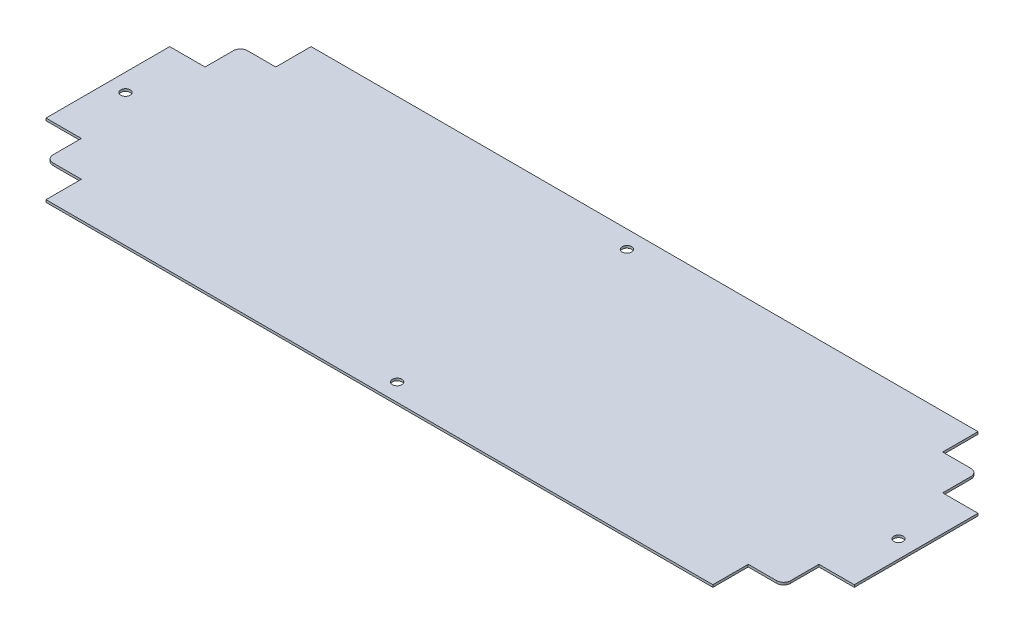
from build123d import *

# Parameters (mm, degrees)
SKETCH1_R           = 2
BOSS_EXTRUDE1_DEPTH = 1


with BuildPart() as part:
    # Sketch1 → Boss-Extrude1 (new body)
    with BuildSketch(Plane(origin=(0, 0, 0), x_dir=(1, 0, 0), z_dir=(0, 1, 0))):
        with BuildLine():
            Line((141.5, 56.25), (-141.5, 56.25))
            Line((-141.5, 56.25), (-141.5, 41.25))
            Line((-141.5, 41.25), (-153.5, 41.25))
            ThreePointArc((-153.5, 41.25), (-155.621320344, 40.371320344), (-156.5, 38.25))
            Line((-156.5, 38.25), (-156.5, 26.25))
            Line((-156.5, 26.25), (-171.5, 26.25))
            Line((-171.5, 26.25), (-171.5, -26.25))
            Line((-171.5, -26.25), (-156.5, -26.25))
            Line((-156.5, -26.25), (-156.5, -38.25))
            ThreePointArc((-156.5, -38.25), (-155.621320344, -40.371320344), (-153.5, -41.25))
            Line((-153.5, -41.25), (-141.5, -41.25))
            Line((-141.5, -41.25), (-141.5, -56.25))
            Line((-141.5, -56.25), (141.5, -56.25))
            Line((141.5, -56.25), (141.5, -41.25))
            Line((141.5, -41.25), (153.5, -41.25))
            ThreePointArc((153.5, -41.25), (155.621320344, -40.371320344), (156.5, -38.25))
            Line((156.5, -38.25), (156.5, -26.25))
            Line((156.5, -26.25), (171.5, -26.25))
            Line((171.5, -26.25), (171.5, 26.25))
            Line((171.5, 26.25), (156.5, 26.25))
            Line((156.5, 26.25), (156.5, 38.25))
            ThreePointArc((156.5, 38.25), (155.621320344, 40.371320344), (153.5, 41.25))
            Line((153.5, 41.25), (141.5, 41.25))
            Line((141.5, 41.25), (141.5, 56.25))
        make_face()
        with Locations((0, 48.75)):
            Circle(SKETCH1_R, mode=Mode.SUBTRACT)
        with Locations((0, -48.75)):
            Circle(SKETCH1_R, mode=Mode.SUBTRACT)
        with Locations((-164, 0)):
            Circle(SKETCH1_R, mode=Mode.SUBTRACT)
        with Locations((164, 0)):
            Circle(SKETCH1_R, mode=Mode.SUBTRACT)
    extrude(amount=BOSS_EXTRUDE1_DEPTH)


solid = part.part
